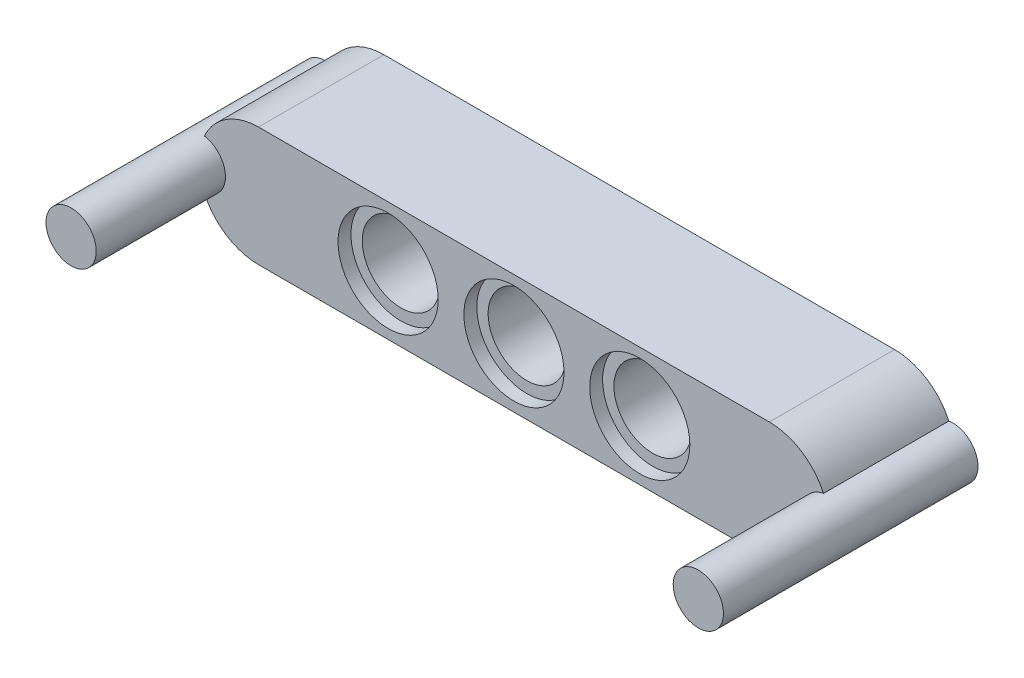
from build123d import *

# Parameters (mm, degrees)
SKETCH1_W                = 39
SKETCH1_H                = 7.38
BOSS_EXTRUDE1_DEPTH      = 7.76
SKETCH2_R                = 2.4
CUT_EXTRUDE1_DEPTH       = 7.76
CUT_EXTRUDE2_OUTLINE_R   = 3.1
CUT_EXTRUDE2_OUTLINE_R_2 = 2.4
CUT_EXTRUDE2_DEPTH       = 0.8
CUT_EXTRUDE3_START       = 6.96
CUT_EXTRUDE3_OUTLINE_R   = 3.1
CUT_EXTRUDE3_OUTLINE_R_2 = 2.4
CUT_EXTRUDE3_DEPTH       = 0.8
LPATTERN3_COUNT          = 3
LPATTERN3_PITCH          = 7.79
LPATTERN6_COUNT          = 3
LPATTERN6_PITCH          = 7.79
FILLET1_R                = 3.69
FILLET2_R                = 3.69
FILLET3_R                = 3.69
FILLET4_R                = 3.69
SKETCH3_R                = 3.1
BOSS_EXTRUDE2_DEPTH      = 7.76
BOSS_EXTRUDE3_START      = -7.76
SKETCH4_R                = 3.1
BOSS_EXTRUDE3_DEPTH      = 7.76
SKETCH11_R               = 1.555
BOSS_EXTRUDE7_DEPTH      = 8
SKETCH12_R               = 1.555
BOSS_EXTRUDE8_DEPTH      = 8
SKETCH14_R               = 1.555
BOSS_EXTRUDE9_DEPTH      = 8


# Read off the part's stored shape, not the designer's step: Cut-Extrude2, Cut-Extrude3
with BuildPart() as part:
    # Sketch1 → Boss-Extrude1 (new body)
    with BuildSketch(Plane.XY):
        with Locations((19.5, 3.69)):
            Rectangle(SKETCH1_W, SKETCH1_H)
    extrude(amount=BOSS_EXTRUDE1_DEPTH)

    # Sketch2 → Cut-Extrude1 (cut)
    with BuildSketch(Plane.XY.offset(7.76)):
        with Locations((19.5, 3.69)):
            Circle(SKETCH2_R)
    cut_extrude1 = extrude(amount=-CUT_EXTRUDE1_DEPTH, mode=Mode.SUBTRACT)

    # Cut-Extrude2 outline → Cut-Extrude2 (cut)
    with BuildSketch(Plane.XY):
        with Locations((19.5, 3.69)):
            Circle(CUT_EXTRUDE2_OUTLINE_R)
        with Locations((19.5, 3.69)):
            Circle(CUT_EXTRUDE2_OUTLINE_R_2, mode=Mode.SUBTRACT)
    cut_extrude2 = extrude(amount=CUT_EXTRUDE2_DEPTH, mode=Mode.SUBTRACT)

    # Cut-Extrude3 outline → Cut-Extrude3 (cut)
    with BuildSketch(Plane.XY.offset(CUT_EXTRUDE3_START)):
        with Locations((19.5, 3.69)):
            Circle(CUT_EXTRUDE3_OUTLINE_R)
        with Locations((19.5, 3.69)):
            Circle(CUT_EXTRUDE3_OUTLINE_R_2, mode=Mode.SUBTRACT)
    cut_extrude3 = extrude(amount=CUT_EXTRUDE3_DEPTH, mode=Mode.SUBTRACT)

    # LPattern3: Cut-Extrude1, Cut-Extrude2, Cut-Extrude3 ×3
    with Locations(*[(-i * LPATTERN3_PITCH, 0, 0) for i in range(1, LPATTERN3_COUNT)]):
        add(cut_extrude1, mode=Mode.SUBTRACT)
        add(cut_extrude2, mode=Mode.SUBTRACT)
        add(cut_extrude3, mode=Mode.SUBTRACT)

    # LPattern6: Cut-Extrude1, Cut-Extrude2, Cut-Extrude3 ×3
    with Locations(*[(i * LPATTERN6_PITCH, 0, 0) for i in range(1, LPATTERN6_COUNT)]):
        add(cut_extrude1, mode=Mode.SUBTRACT)
        add(cut_extrude2, mode=Mode.SUBTRACT)
        add(cut_extrude3, mode=Mode.SUBTRACT)

    # Fillet1
    fillet1_edges = [part.edges().sort_by_distance(p)[0] for p in [
        (0, 7.38, 3.88),
    ]]
    fillet(fillet1_edges, radius=FILLET1_R)

    # Fillet2
    fillet2_edges = [part.edges().sort_by_distance(p)[0] for p in [
        (0, 0, 3.88),
    ]]
    fillet(fillet2_edges, radius=FILLET2_R - 0.0001)  # a hair under: the kernel refuses the full size

    # Fillet3
    fillet3_edges = [part.edges().sort_by_distance(p)[0] for p in [
        (39, 7.38, 3.88),
    ]]
    fillet(fillet3_edges, radius=FILLET3_R)

    # Fillet4
    fillet4_edges = [part.edges().sort_by_distance(p)[0] for p in [
        (39, 0, 3.88),
    ]]
    fillet(fillet4_edges, radius=FILLET4_R - 0.0001)  # a hair under: the kernel refuses the full size

    # Sketch3 → Boss-Extrude2 (add)
    with BuildSketch(Plane(origin=(0, 0, 0), x_dir=(-1, 0, 0), z_dir=(0, 0, -1))):
        with Locations((-35.08, 3.69)):
            Circle(SKETCH3_R)
    extrude(amount=-BOSS_EXTRUDE2_DEPTH)

    # Sketch4 → Boss-Extrude3 (add)
    with BuildSketch(Plane.XY.offset(7.76).offset(BOSS_EXTRUDE3_START)):
        with Locations((3.92, 3.69)):
            Circle(SKETCH4_R)
    extrude(amount=BOSS_EXTRUDE3_DEPTH)

    # Sketch11 → Boss-Extrude7 (add)
    with BuildSketch(Plane.XY.offset(7.76)):
        with Locations(Location((0.085, 3.69, 0), (0, 0, 279.228133411))):
            Circle(SKETCH11_R)
        with Locations(Location((38.915, 3.69, 0), (0, 0, 99.228133411))):
            Circle(SKETCH11_R)
    extrude(amount=BOSS_EXTRUDE7_DEPTH)

    # Sketch12 → Boss-Extrude8 (add)
    with BuildSketch(Plane(origin=(0, 0, 0), x_dir=(-1, 0, 0), z_dir=(0, 0, -1))):
        with Locations(Location((-38.915, 3.69, 0), (0, 0, 80.771866589))):
            Circle(SKETCH12_R)
    extrude(amount=-BOSS_EXTRUDE8_DEPTH)

    # Sketch14 → Boss-Extrude9 (add)
    with BuildSketch(Plane(origin=(0, 0, 0), x_dir=(-1, 0, 0), z_dir=(0, 0, -1))):
        with Locations(Location((-0.085, 3.69, 0), (0, 0, 99.228133411))):
            Circle(SKETCH14_R)
    extrude(amount=-BOSS_EXTRUDE9_DEPTH)


solid = part.part
